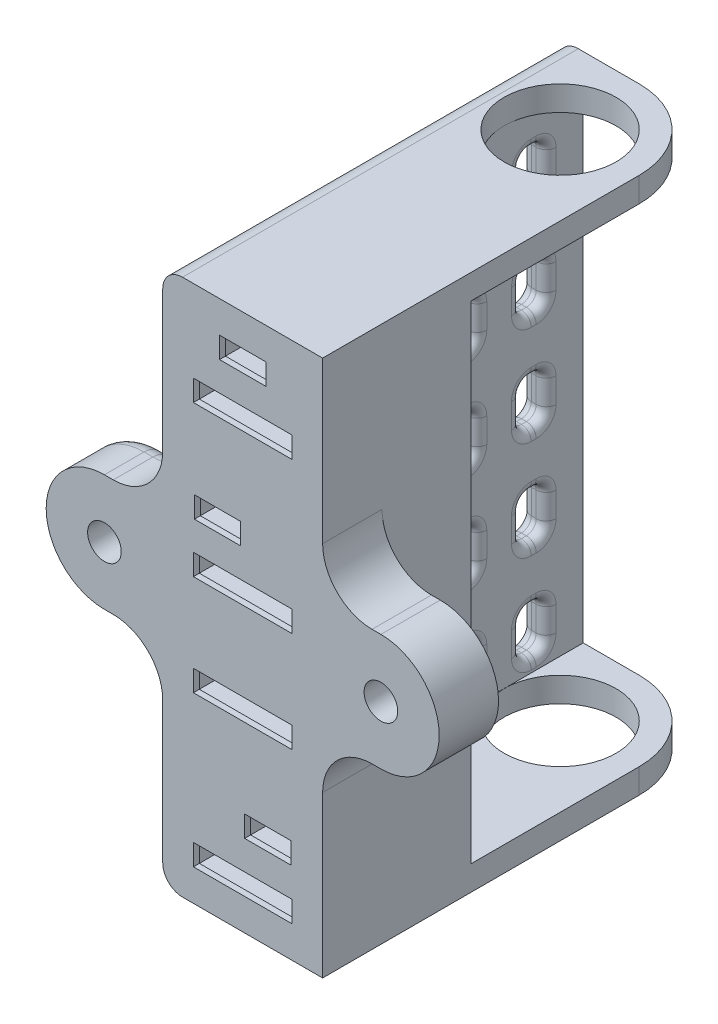
from build123d import *

# Parameters (mm, degrees)
ESQUISSE1_W                                        = 16.16
ESQUISSE1_H                                        = 54.26
BOSS_EXTRU_1_DEPTH                                 = 15
ESQUISSE2_W                                        = 5.28
ESQUISSE2_H                                        = 2.74
ESQUISSE2_W_2                                      = 10.56
ENL_V_MAT_EXTRU_1_DEPTH                            = 33.036280995
ESQUISSE4_W                                        = 10.56
ESQUISSE4_H                                        = 2.74
ESQUISSE4_W_2                                      = 9.96
ESQUISSE4_H_2                                      = 2.14
ESQUISSE4_W_3                                      = 5.28
ESQUISSE4_W_4                                      = 4.68
BOSS_EXTRU_2_DEPTH                                 = 0.6
ESQUISSE5_W                                        = 2.5
ESQUISSE5_H                                        = 54.26
BOSS_EXTRU_3_DEPTH                                 = 25
ESQUISSE7_W                                        = 2.5
ESQUISSE7_H                                        = 4.5
ENL_V_MAT_EXTRU_3_DEPTH                            = 40.3399606
R_P_TITION_LIN_AIRE1_COUNT                         = 5
R_P_TITION_LIN_AIRE1_PITCH                         = 10
CONG_2_R                                           = 1
ESQUISSE11_W                                       = 13.66
ESQUISSE11_H                                       = 25
BOSS_EXTRU_6_DEPTH                                 = 2.5
CONG_4_R                                           = 8
ESQUISSE12_R                                       = 5.66
ENL_V_MAT_EXTRU_4_DEPTH                            = 59.046395237
CONG_4_OF_SYM_TRIE1_R                              = 8
BOSS_EXTRU_7_DEPTH                                 = 6
CHAMBRAGE_POUR_VIS_T_TE_RONDE_BOMB_E_M_D           = 3.4
CHAMBRAGE_POUR_VIS_T_TE_RONDE_BOMB_E_M_CBORE_D     = 7
CHAMBRAGE_POUR_VIS_T_TE_RONDE_BOMB_E_M_CBORE_DEPTH = 2.4
CONG_5_R                                           = 5
CONG_6_R                                           = 2
CONG_7_R                                           = 2


with BuildPart() as part:
    # Esquisse1 → Boss.-Extru.1 (new body)
    with BuildSketch(Plane.XY):
        Rectangle(ESQUISSE1_W, ESQUISSE1_H)
    extrude(amount=BOSS_EXTRU_1_DEPTH)

    # Esquisse2 → Enlèv. mat.-Extru.1 (cut, through all)
    with BuildSketch(Plane(origin=(0, 0, 0), x_dir=(-1, 0, 0), z_dir=(0, 0, -1))):
        with Locations((0, 22.86)):
            Rectangle(ESQUISSE2_W, ESQUISSE2_H)
        with Locations((0, 17.78)):
            Rectangle(ESQUISSE2_W_2, ESQUISSE2_H)
        with Locations((2.54, 7.62)):
            Rectangle(ESQUISSE2_W, ESQUISSE2_H)
        with Locations((0, 2.54)):
            Rectangle(ESQUISSE2_W_2, ESQUISSE2_H)
        with Locations((0, -7.62)):
            Rectangle(ESQUISSE2_W_2, ESQUISSE2_H)
        with Locations((-2.54, -17.78)):
            Rectangle(ESQUISSE2_W, ESQUISSE2_H)
        with Locations((0, -22.86)):
            Rectangle(ESQUISSE2_W_2, ESQUISSE2_H)
    extrude(amount=-ENL_V_MAT_EXTRU_1_DEPTH, mode=Mode.SUBTRACT)

    # Esquisse4 → Boss.-Extru.2 (add)
    # profile 1 of 7: a face of its own
    with BuildSketch(Plane.XY.offset(15)):
        with Locations((0, 17.78)):
            Rectangle(ESQUISSE4_W, ESQUISSE4_H)
        with Locations((0, 17.78)):
            Rectangle(ESQUISSE4_W_2, ESQUISSE4_H_2, mode=Mode.SUBTRACT)
    # profile 2 of 7: a face of its own
    with BuildSketch(Plane.XY.offset(15)):
        with Locations((0, 22.86)):
            Rectangle(ESQUISSE4_W_3, ESQUISSE4_H)
        with Locations((0, 22.86)):
            Rectangle(ESQUISSE4_W_4, ESQUISSE4_H_2, mode=Mode.SUBTRACT)
    # profile 3 of 7: a face of its own
    with BuildSketch(Plane.XY.offset(15)):
        with Locations((-2.54, 7.62)):
            Rectangle(ESQUISSE4_W_3, ESQUISSE4_H)
        with Locations((-2.54, 7.62)):
            Rectangle(ESQUISSE4_W_4, ESQUISSE4_H_2, mode=Mode.SUBTRACT)
    # profile 4 of 7: a face of its own
    with BuildSketch(Plane.XY.offset(15)):
        with Locations((0, 2.54)):
            Rectangle(ESQUISSE4_W, ESQUISSE4_H)
        with Locations((0, 2.54)):
            Rectangle(ESQUISSE4_W_2, ESQUISSE4_H_2, mode=Mode.SUBTRACT)
    # profile 5 of 7: a face of its own
    with BuildSketch(Plane.XY.offset(15)):
        with Locations((0, -7.62)):
            Rectangle(ESQUISSE4_W, ESQUISSE4_H)
        with Locations((0, -7.62)):
            Rectangle(ESQUISSE4_W_2, ESQUISSE4_H_2, mode=Mode.SUBTRACT)
    # profile 6 of 7: a face of its own
    with BuildSketch(Plane.XY.offset(15)):
        with Locations((2.54, -17.78)):
            Rectangle(ESQUISSE4_W_3, ESQUISSE4_H)
        with Locations((2.54, -17.78)):
            Rectangle(ESQUISSE4_W_4, ESQUISSE4_H_2, mode=Mode.SUBTRACT)
    # profile 7 of 7: a face of its own
    with BuildSketch(Plane.XY.offset(15)):
        with Locations((0, -22.86)):
            Rectangle(ESQUISSE4_W, ESQUISSE4_H)
        with Locations((0, -22.86)):
            Rectangle(ESQUISSE4_W_2, ESQUISSE4_H_2, mode=Mode.SUBTRACT)
    extrude(amount=-BOSS_EXTRU_2_DEPTH)

    # Esquisse5 → Boss.-Extru.3 (add)
    with BuildSketch(Plane(origin=(0, 0, 0), x_dir=(-1, 0, 0), z_dir=(0, 0, -1))):
        with Locations((6.83, 0)):
            Rectangle(ESQUISSE5_W, ESQUISSE5_H)
    extrude(amount=BOSS_EXTRU_3_DEPTH)

    # Esquisse7 → Enlèv. mat.-Extru.3 (cut, through all)
    with BuildSketch(Plane(origin=(-5.58, 0, 0), x_dir=(0, 0, -1), z_dir=(1, 0, 0))):
        with Locations((20, -21.13)):
            Rectangle(ESQUISSE7_W, ESQUISSE7_H)
        with Locations((13, -21.13)):
            Rectangle(ESQUISSE7_W, ESQUISSE7_H)
    enl_v_mat_extru_3 = extrude(amount=-ENL_V_MAT_EXTRU_3_DEPTH, mode=Mode.SUBTRACT)

    # Répétition linéaire1: Enlèv. mat.-Extru.3 ×5
    with Locations(*[(0, i * R_P_TITION_LIN_AIRE1_PITCH, 0) for i in range(1, R_P_TITION_LIN_AIRE1_COUNT)]):
        add(enl_v_mat_extru_3, mode=Mode.SUBTRACT)

    # Congé2
    cong_2_edges = [part.edges().sort_by_distance(p)[0] for p in [
        (-8.08, -21.13, -21.25),
        (-6.83, -18.88, -21.25),
        (-8.08, -23.38, -20),
        (-6.83, -23.38, -21.25),
        (-8.08, -21.13, -18.75),
        (-6.83, -23.38, -18.75),
        (-8.08, -18.88, -20),
        (-6.83, -18.88, -18.75),
        (-5.58, -21.13, -21.25),
        (-5.58, -18.88, -20),
        (-5.58, -21.13, -18.75),
        (-5.58, -23.38, -20),
        (-8.08, -21.13, -14.25),
        (-6.83, -18.88, -14.25),
        (-8.08, -23.38, -13),
        (-6.83, -23.38, -14.25),
        (-8.08, -21.13, -11.75),
        (-6.83, -23.38, -11.75),
        (-8.08, -18.88, -13),
        (-6.83, -18.88, -11.75),
        (-5.58, -21.13, -14.25),
        (-5.58, -18.88, -13),
        (-5.58, -21.13, -11.75),
        (-5.58, -23.38, -13),
        (-5.58, -11.13, -21.25),
        (-5.58, -8.88, -20),
        (-5.58, -11.13, -18.75),
        (-5.58, -13.38, -20),
        (-8.08, -11.13, -21.25),
        (-6.83, -8.88, -21.25),
        (-8.08, -13.38, -20),
        (-6.83, -13.38, -21.25),
        (-8.08, -11.13, -18.75),
        (-6.83, -13.38, -18.75),
        (-8.08, -8.88, -20),
        (-6.83, -8.88, -18.75),
        (-5.58, -1.13, -21.25),
        (-5.58, -3.38, -20),
        (-5.58, -1.13, -18.75),
        (-5.58, 1.12, -20),
        (-8.08, -1.13, -21.25),
        (-8.08, 1.12, -20),
        (-8.08, -1.13, -18.75),
        (-8.08, -3.38, -20),
        (-6.83, 1.12, -21.25),
        (-6.83, -3.38, -21.25),
        (-6.83, -3.38, -18.75),
        (-6.83, 1.12, -18.75),
        (-5.58, 8.87, -21.25),
        (-5.58, 6.62, -20),
        (-5.58, 8.87, -18.75),
        (-5.58, 11.12, -20),
        (-8.08, 8.87, -21.25),
        (-8.08, 11.12, -20),
        (-8.08, 8.87, -18.75),
        (-8.08, 6.62, -20),
        (-6.83, 11.12, -21.25),
        (-6.83, 6.62, -21.25),
        (-6.83, 6.62, -18.75),
        (-6.83, 11.12, -18.75),
        (-5.58, 18.87, -21.25),
        (-5.58, 16.62, -20),
        (-5.58, 18.87, -18.75),
        (-5.58, 21.12, -20),
        (-8.08, 18.87, -21.25),
        (-8.08, 21.12, -20),
        (-8.08, 18.87, -18.75),
        (-8.08, 16.62, -20),
        (-6.83, 21.12, -21.25),
        (-6.83, 16.62, -21.25),
        (-6.83, 16.62, -18.75),
        (-6.83, 21.12, -18.75),
        (-5.58, -11.13, -14.25),
        (-5.58, -8.88, -13),
        (-5.58, -11.13, -11.75),
        (-5.58, -13.38, -13),
        (-8.08, -11.13, -14.25),
        (-6.83, -8.88, -14.25),
        (-8.08, -13.38, -13),
        (-6.83, -13.38, -14.25),
        (-8.08, -11.13, -11.75),
        (-6.83, -13.38, -11.75),
        (-8.08, -8.88, -13),
        (-6.83, -8.88, -11.75),
        (-5.58, -1.13, -14.25),
        (-5.58, -3.38, -13),
        (-5.58, -1.13, -11.75),
        (-5.58, 1.12, -13),
        (-8.08, -1.13, -14.25),
        (-8.08, 1.12, -13),
        (-8.08, -1.13, -11.75),
        (-8.08, -3.38, -13),
        (-6.83, 1.12, -14.25),
        (-6.83, -3.38, -14.25),
        (-6.83, -3.38, -11.75),
        (-6.83, 1.12, -11.75),
        (-5.58, 8.87, -14.25),
        (-5.58, 6.62, -13),
        (-5.58, 8.87, -11.75),
        (-5.58, 11.12, -13),
        (-8.08, 8.87, -14.25),
        (-8.08, 11.12, -13),
        (-8.08, 8.87, -11.75),
        (-8.08, 6.62, -13),
        (-6.83, 11.12, -14.25),
        (-6.83, 6.62, -14.25),
        (-6.83, 6.62, -11.75),
        (-6.83, 11.12, -11.75),
        (-5.58, 18.87, -14.25),
        (-5.58, 16.62, -13),
        (-5.58, 18.87, -11.75),
        (-5.58, 21.12, -13),
        (-8.08, 18.87, -14.25),
        (-8.08, 21.12, -13),
        (-8.08, 18.87, -11.75),
        (-8.08, 16.62, -13),
        (-6.83, 21.12, -14.25),
        (-6.83, 16.62, -14.25),
        (-6.83, 16.62, -11.75),
        (-6.83, 21.12, -11.75),
    ]]
    fillet(cong_2_edges, radius=CONG_2_R)

    # Esquisse11 → Boss.-Extru.6 (add)
    with BuildSketch(Plane.XZ.offset(27.13)):
        with Locations((1.25, -12.5)):
            Rectangle(ESQUISSE11_W, ESQUISSE11_H)
    boss_extru_6 = extrude(amount=-BOSS_EXTRU_6_DEPTH)

    # Congé4
    cong_4_edges = [part.edges().sort_by_distance(p)[0] for p in [
        (8.08, -25.88, -25),
    ]]
    fillet(cong_4_edges, radius=CONG_4_R)

    # Esquisse12 → Enlèv. mat.-Extru.4 (cut, through all)
    with BuildSketch(Plane(origin=(0, -24.63, 0), x_dir=(1, 0, 0), z_dir=(0, 1, 0))):
        with Locations(Location((0.08, 17, 0), (0, 0, 270))):
            Circle(ESQUISSE12_R)
    enl_v_mat_extru_4 = extrude(amount=-ENL_V_MAT_EXTRU_4_DEPTH, mode=Mode.SUBTRACT)

    # Symétrie1: Boss.-Extru.6, Enlèv. mat.-Extru.4 across plane
    add(boss_extru_6.mirror(Plane.ZX))
    add(enl_v_mat_extru_4.mirror(Plane.ZX), mode=Mode.SUBTRACT)

    # Congé4 of Symétrie1
    cong_4_of_sym_trie1_edges = [part.edges().sort_by_distance(p)[0] for p in [
        (8.08, 25.88, -25),
    ]]
    fillet(cong_4_of_sym_trie1_edges, radius=CONG_4_OF_SYM_TRIE1_R)

    # Esquisse13 → Boss.-Extru.7 (add)
    with BuildSketch(Plane.XY.offset(15)):
        with BuildLine():
            ThreePointArc((13.97, -5.89), (19.86, 0), (13.97, 5.89))
            Line((13.97, 5.89), (8.08, 5.89))
            Line((8.08, 5.89), (8.08, -5.89))
            Line((8.08, -5.89), (13.97, -5.89))
        make_face()
        with BuildLine():
            Line((-8.08, -5.89), (-8.08, 5.89))
            Line((-8.08, 5.89), (-13.97, 5.89))
            ThreePointArc((-13.97, 5.89), (-19.86, 0), (-13.97, -5.89))
            Line((-13.97, -5.89), (-8.08, -5.89))
        make_face()
    extrude(amount=-BOSS_EXTRU_7_DEPTH)

    # Chambrage pour vis à tête ronde bombée M31 (through all)
    with Locations(Plane(origin=(0, 0, 9), x_dir=(-1, 0, 0), z_dir=(0, 0, -1))):
        with Locations((-13.97, 0), (13.97, 0)):
            CounterBoreHole(CHAMBRAGE_POUR_VIS_T_TE_RONDE_BOMB_E_M_D / 2, CHAMBRAGE_POUR_VIS_T_TE_RONDE_BOMB_E_M_CBORE_D / 2, CHAMBRAGE_POUR_VIS_T_TE_RONDE_BOMB_E_M_CBORE_DEPTH)

    # Congé5
    cong_5_edges = [part.edges().sort_by_distance(p)[0] for p in [
        (8.08, -5.89, 12),
        (8.08, 5.89, 12),
        (-8.08, 5.89, 12),
        (-8.08, -5.89, 12),
    ]]
    fillet(cong_5_edges, radius=CONG_5_R)

    # Congé6
    cong_6_edges = [part.edges().sort_by_distance(p)[0] for p in [
        (-8.08, -27.13, -5),
        (-8.08, 27.13, -5),
    ]]
    fillet(cong_6_edges, radius=CONG_6_R)

    # Congé7
    # the kernel refuses this fillet: 2 mm, written as the material it takes off along each edge
    with BuildSketch(Plane(origin=(-13.97, -5.89, 9), x_dir=(0, 0, 1), z_dir=(1, 0, 0)), Plane(origin=(-13.08, 5.89, 9), x_dir=(0, 0, 1), z_dir=(-1, 0, 0))) as cong_7_piece_1:
        with BuildLine():
            CenterArc((CONG_7_R, -CONG_7_R), CONG_7_R, 90, 90)
            Line((0, -CONG_7_R), (0, 0))
            Line((0, 0), (CONG_7_R, 0))
        make_face()
    extrude(amount=0.89, mode=Mode.SUBTRACT)
    with BuildSketch(Plane(origin=(-13.97, 0, 9), x_dir=(0, 1, 0), z_dir=(1, 0, 0))) as cong_7_piece_2:
        with BuildLine():
            CenterArc((5.89 - CONG_7_R, CONG_7_R), CONG_7_R, 270, 90)
            Line((5.89 - CONG_7_R, 0), (5.89, 0))
            Line((5.89, 0), (5.89, CONG_7_R))
        make_face()
    revolve(axis=Axis((-13.97, 0, 9), (0, 0, 1)), revolution_arc=180, mode=Mode.SUBTRACT)
    with BuildSketch(Plane(origin=(-13.08, 10.89, 9), x_dir=(0.5399642365263265, 0.8416879607506225, 0), z_dir=(-0.8416879607506225, 0.5399642365263265, 0))) as cong_7_piece_3_section:
        with BuildLine():
            CenterArc((5 + CONG_7_R, -CONG_7_R), CONG_7_R, 90, 90)
            Line((5 + CONG_7_R, 0), (5, 0))
            Line((5, 0), (5, -CONG_7_R))
        make_face()
    cong_7_piece_3 = revolve(axis=Axis((-13.08, 10.89, 9), (0, 0, -1)), revolution_arc=147.318795695, mode=Mode.PRIVATE)
    cong_7_piece_3 = split(cong_7_piece_3, bisect_by=Plane(origin=(-8.08, 7.276931104, 9.526930679), z_dir=(-1, 0, 0)), keep=Keep.TOP, mode=Mode.PRIVATE)
    add(cong_7_piece_3, mode=Mode.SUBTRACT)
    with BuildSketch(Plane(origin=(-13.08, -10.89, 9), x_dir=(0.5399642365263269, -0.8416879607506221, 0), z_dir=(-0.8416879607506221, -0.5399642365263269, 0))) as cong_7_piece_4_section:
        with BuildLine():
            CenterArc((5 + CONG_7_R, CONG_7_R), CONG_7_R, 180, 90)
            Line((5 + CONG_7_R, 0), (5, 0))
            Line((5, 0), (5, CONG_7_R))
        make_face()
    cong_7_piece_4 = revolve(axis=Axis((-13.08, -10.89, 9), (0, 0, 1)), revolution_arc=147.318795695, mode=Mode.PRIVATE)
    cong_7_piece_4 = split(cong_7_piece_4, bisect_by=Plane(origin=(-8.08, -7.276930885, 9.526929942), z_dir=(-1, 0, 0)), keep=Keep.TOP, mode=Mode.PRIVATE)
    add(cong_7_piece_4, mode=Mode.SUBTRACT)


solid = part.part
